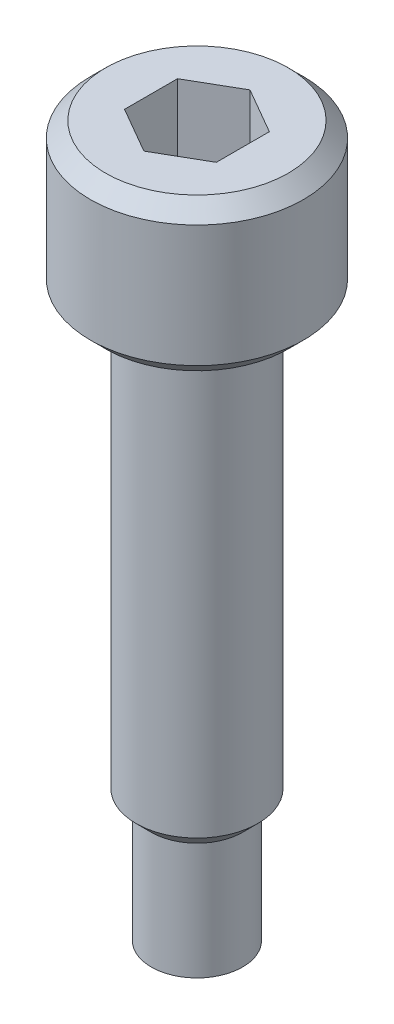
from build123d import *

# Parameters (mm, degrees)
CHAMFER1_SIZE      = 1.5
CUT_EXTRUDE1_DEPTH = 8


with BuildPart() as part:
    # Sketch1 → Revolve1 (revolve)
    with BuildSketch(Plane.XY, mode=Mode.PRIVATE) as revolve1_sk:
        Polygon((0, 0), (4.5, 0), (4.5, 11.5), (6, 11.5), (6, 55), (10.5, 55), (10.5, 70), (0, 70), align=None)
    revolve(revolve1_sk.sketch.rotate(Axis((0, 70, 0), (0, -1, 0)), 180), axis=Axis((0, 70, 0), (0, -1, 0)))

    # Chamfer1
    chamfer1_edges = [part.edges().sort_by_distance(p)[0] for p in [
        (10.5, 70, 0),
        (10.5, 55, 0),
        (6, 11.5, 0),
    ]]
    chamfer(chamfer1_edges, length=CHAMFER1_SIZE - 0.0001)  # a hair under: the kernel refuses the full size

    # Sketch2 → Cut-Extrude1 (cut)
    with BuildSketch(Plane(origin=(0, 70, 0), x_dir=(1, 0, 0), z_dir=(0, 1, 0))):
        Polygon((0, 5.22463141), (-4.524663526, 2.612315705), (-4.524663526, -2.612315705), (0, -5.22463141), (4.524663526, -2.612315705), (4.524663526, 2.612315705), align=None)
    extrude(amount=-CUT_EXTRUDE1_DEPTH, mode=Mode.SUBTRACT)


solid = part.part
